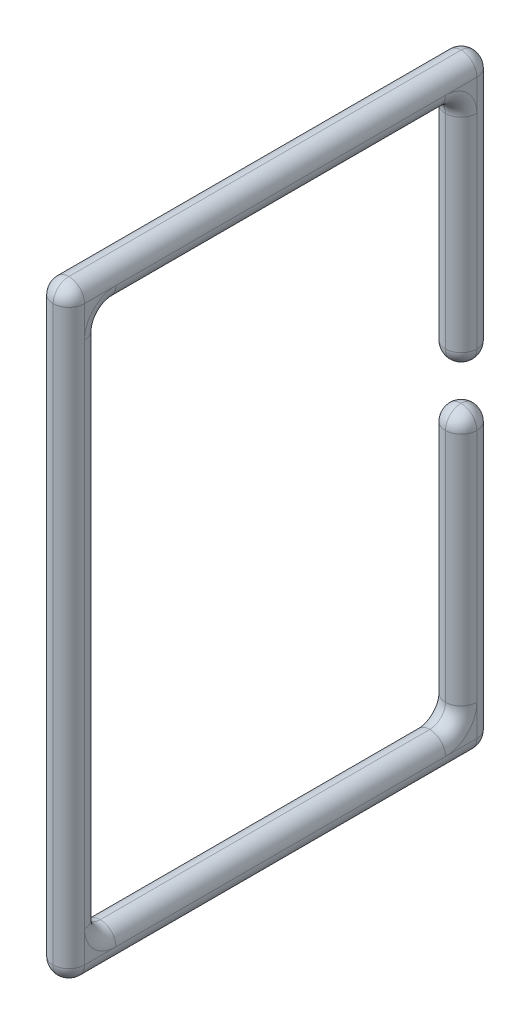
from build123d import *

# Parameters (mm, degrees)
SZKIC1_W                    = 4
SZKIC1_H                    = 4
DODANIE_WYCI_GNI_CIE1_DEPTH = 34
SZKIC2_W                    = 4
SZKIC2_H                    = 4
DODANIE_WYCI_GNI_CIE2_DEPTH = 50
SZKIC3_W                    = 4
SZKIC3_H                    = 4
DODANIE_WYCI_GNI_CIE3_DEPTH = 73
SZKIC4_W                    = 4
SZKIC4_H                    = 4
DODANIE_WYCI_GNI_CIE4_DEPTH = 50
SZKIC5_W                    = 4
SZKIC5_H                    = 4
DODANIE_WYCI_GNI_CIE5_DEPTH = 34
ZAOKR_GLENIE1_R             = 2


with BuildPart() as part:
    # Szkic1 → Dodanie-wyciągnięcie1 (new body)
    with BuildSketch(Plane(origin=(0, 0, 0), x_dir=(1, 0, 0), z_dir=(0, 1, 0))):
        Rectangle(SZKIC1_W, SZKIC1_H)
    extrude(amount=DODANIE_WYCI_GNI_CIE1_DEPTH)

    # Szkic2 → Dodanie-wyciągnięcie2 (add)
    with BuildSketch(Plane.XY.offset(2)):
        with Locations((0, 32)):
            Rectangle(SZKIC2_W, SZKIC2_H)
    extrude(amount=DODANIE_WYCI_GNI_CIE2_DEPTH)

    # Szkic3 → Dodanie-wyciągnięcie3 (add)
    with BuildSketch(Plane.XZ.offset(-30)):
        with Locations((0, 50)):
            Rectangle(SZKIC3_W, SZKIC3_H)
    extrude(amount=DODANIE_WYCI_GNI_CIE3_DEPTH)

    # Szkic4 → Dodanie-wyciągnięcie4 (add)
    with BuildSketch(Plane(origin=(0, 0, 48), x_dir=(-1, 0, 0), z_dir=(0, 0, -1))):
        with Locations((0, -41)):
            Rectangle(SZKIC4_W, SZKIC4_H)
    extrude(amount=DODANIE_WYCI_GNI_CIE4_DEPTH)

    # Szkic5 → Dodanie-wyciągnięcie5 (add)
    with BuildSketch(Plane(origin=(0, -39, 0), x_dir=(1, 0, 0), z_dir=(0, 1, 0))):
        Rectangle(SZKIC5_W, SZKIC5_H)
    extrude(amount=DODANIE_WYCI_GNI_CIE5_DEPTH)

    # Zaokrąglenie1
    zaokr_glenie1_edges = [part.edges().sort_by_distance(p)[0] for p in [
        (2, 34, 25),
        (0, 34, -2),
        (2, 15, 2),
        (-2, 15, 2),
        (0, 30, 2),
        (-2, -4.5, 52),
        (2, -4.5, 52),
        (0, 34, 52),
        (2, 30, 25),
        (-2, 30, 25),
        (0, 30, 48),
        (-2, -43, 25),
        (2, -43, 25),
        (0, -43, 52),
        (2, -4.5, 48),
        (-2, -4.5, 48),
        (-2, 34, 25),
        (0, -39, 48),
        (-2, -24, -2),
        (2, -24, -2),
        (0, -43, -2),
        (0, 0, -2),
        (2, 0, 0),
        (2, -39, 25),
        (-2, -39, 25),
        (0, 0, 2),
        (2, -22, 2),
        (0, -39, 2),
        (-2, -22, 2),
        (2, -5, 0),
        (0, -5, -2),
        (-2, -5, 0),
        (0, -5, 2),
        (-2, 0, 0),
        (-2, 17, -2),
        (2, 17, -2),
    ]]
    fillet(zaokr_glenie1_edges, radius=ZAOKR_GLENIE1_R - 0.0001)  # a hair under: the kernel refuses the full size


solid = part.part
